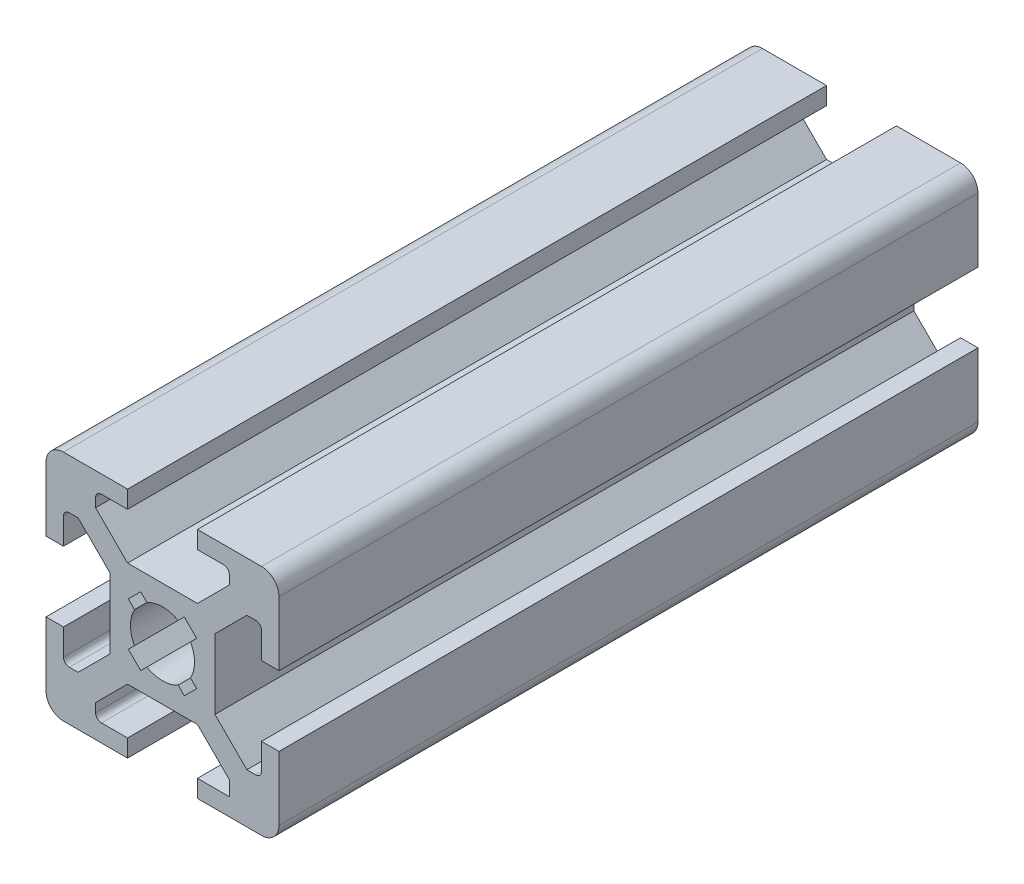
from build123d import *

# Parameters (mm, degrees)
SALIENTE_EXTRUIR1_DEPTH = 60
REDONDEO1_R             = 1.5
REDONDEO2_R             = 0.5
CORTAR_EXTRUIR1_DEPTH   = 62.64414003


with BuildPart() as part:
    # Croquis1 → Saliente-Extruir1 (new body)
    with BuildSketch(Plane.XY):
        Polygon((3, -4.5), (5.7413765, -7.2413765), (5.7413765, -8.5), (3, -8.5), (3, -10), (10, -10), (10, -3), (8.5, -3), (8.5, -5.7413765), (7.2413765, -5.7413765), (4.5, -3), (4.5, 3), (7.2413765, 5.7413765), (8.5, 5.7413765), (8.5, 3), (10, 3), (10, 10), (3, 10), (3, 8.5), (5.7413765, 8.5), (5.7413765, 7.2413765), (3, 4.5), (-3, 4.5), (-5.7413765, 7.2413765), (-5.7413765, 8.5), (-3, 8.5), (-3, 10), (-10, 10), (-10, 3), (-8.5, 3), (-8.5, 5.7413765), (-7.2413765, 5.7413765), (-4.5, 3), (-4.5, -3), (-7.2413765, -5.7413765), (-8.5, -5.7413765), (-8.5, -3), (-10, -3), (-10, -10), (-3, -10), (-3, -8.5), (-5.7413765, -8.5), (-5.7413765, -7.2413765), (-3, -4.5), align=None)
    extrude(amount=SALIENTE_EXTRUIR1_DEPTH)

    # Redondeo1
    redondeo1_edges = [part.edges().sort_by_distance(p)[0] for p in [
        (10, -10, 30),
        (-10, -10, 30),
        (10, 10, 30),
        (-10, 10, 30),
    ]]
    fillet(redondeo1_edges, radius=REDONDEO1_R)

    # Redondeo2
    redondeo2_edges = [part.edges().sort_by_distance(p)[0] for p in [
        (-5.7413765, -8.5, 30),
        (5.7413765, 8.5, 30),
        (-5.7413765, 8.5, 30),
        (8.5, -5.7413765, 30),
        (-8.5, -5.7413765, 30),
        (8.5, 5.7413765, 30),
        (-8.5, 5.7413765, 30),
    ]]
    fillet(redondeo2_edges, radius=REDONDEO2_R)

    # Croquis2 → Cortar-Extruir1 (cut, through all)
    with BuildSketch(Plane(origin=(0, 0, 0), x_dir=(-1, 0, 0), z_dir=(0, 0, -1))):
        with BuildLine():
            Line((-1.340498607, 2.401158779), (-1.870828693, 2.931488865))
            Line((-1.870828693, 2.931488865), (-2.931488865, 1.870828693))
            Line((-2.931488865, 1.870828693), (-2.401158779, 1.340498607))
            ThreePointArc((-2.401158779, 1.340498607), (-2.75, 0), (-2.401158779, -1.340498607))
            Line((-2.401158779, -1.340498607), (-2.931488865, -1.870828693))
            Line((-2.931488865, -1.870828693), (-1.870828693, -2.931488865))
            Line((-1.870828693, -2.931488865), (-1.340498607, -2.401158779))
            ThreePointArc((-1.340498607, -2.401158779), (0, -2.75), (1.340498607, -2.401158779))
            Line((1.340498607, -2.401158779), (1.870828693, -2.931488865))
            Line((1.870828693, -2.931488865), (2.931488865, -1.870828693))
            Line((2.931488865, -1.870828693), (2.401158779, -1.340498607))
            ThreePointArc((2.401158779, -1.340498607), (2.75, 0), (2.401158779, 1.340498607))
            Line((2.401158779, 1.340498607), (2.931488865, 1.870828693))
            Line((2.931488865, 1.870828693), (1.870828693, 2.931488865))
            Line((1.870828693, 2.931488865), (1.340498607, 2.401158779))
            ThreePointArc((1.340498607, 2.401158779), (0, 2.75), (-1.340498607, 2.401158779))
        make_face()
    extrude(amount=-CORTAR_EXTRUIR1_DEPTH, mode=Mode.SUBTRACT)


solid = part.part
